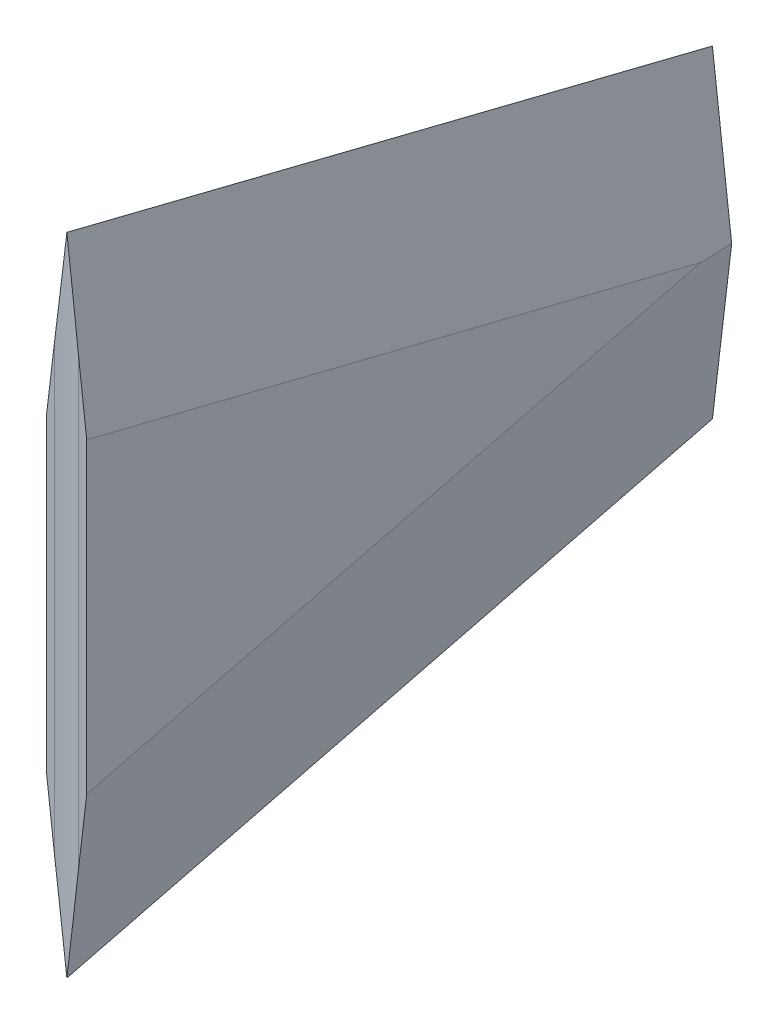
from build123d import *

# Parameters (mm, degrees)
SKETCH1_W               = 101.6
SKETCH1_H               = 50.8
BOSS_EXTRUDE1_DEPTH     = 6.35
CHAMFER1_SIZE           = 3.175
CHAMFER1_SIZE2          = 25.858299909
CHAMFER2_SIZE           = 3.175
CHAMFER2_SIZE_2         = 25.858299909
CHAMFER3_SIZE           = 3.175
CHAMFER3_SIZE2          = 25.858299909
CHAMFER4_SIZE           = 3.175
CHAMFER4_SIZE_2         = 25.858299909
CUT_EXTRUDE1_DEPTH      = 76.2
CUT_EXTRUDE1_DEPTH_BACK = 25.4


with BuildPart() as part:
    # Sketch1 → Boss-Extrude1 (new body)
    with BuildSketch(Plane(origin=(0, 0, 0), x_dir=(0, 0, -1), z_dir=(1, 0, 0))):
        with Locations((50.8, 25.4)):
            Rectangle(SKETCH1_W, SKETCH1_H)
        Polygon((0, 76.2), (101.6, 50.8), (0, 50.8), align=None)
        Polygon((0, 0), (0, -25.4), (101.6, 0), align=None)
    extrude(amount=BOSS_EXTRUDE1_DEPTH)

    # Chamfer1
    chamfer1_edges = [part.edges().sort_by_distance(p)[0] for p in [
        (0, 63.5, -50.8),
    ]]
    chamfer1_side = [part.faces().sort_by_distance(p)[0] for p in [
        (3.175, 63.5, -50.8),
    ]]
    chamfer(chamfer1_edges, length=CHAMFER1_SIZE, length2=CHAMFER1_SIZE2, reference=chamfer1_side[0])

    # Chamfer2
    # the kernel refuses this chamfer: 25.858299909, 3.175 mm, written as the material it takes off along each edge
    with BuildSketch(Plane(origin=(6.35, 92.501557672, 65.20623069), x_dir=(-0.954887306003921, 0.28810166968922074, -0.07202541742230516), z_dir=(0, -0.24253562503633294, -0.970142500145332))) as chamfer2_piece_1:
        Polygon((CHAMFER2_SIZE * 0.954887306004, -CHAMFER2_SIZE * 0.296968403761), (-CHAMFER2_SIZE_2 * 0.296968403759, -CHAMFER2_SIZE_2 * 0.954887305997), (0, 0), align=None)
    extrude(amount=239.152971182, mode=Mode.SUBTRACT)

    # Chamfer3
    chamfer3_edges = [part.edges().sort_by_distance(p)[0] for p in [
        (0, -12.7, -50.8),
    ]]
    chamfer3_side = [part.faces().sort_by_distance(p)[0] for p in [
        (3.175, -12.7, -50.8),
    ]]
    chamfer(chamfer3_edges, length=CHAMFER3_SIZE, length2=CHAMFER3_SIZE2, reference=chamfer3_side[0])

    # Chamfer4
    # the kernel refuses this chamfer: 25.858299909, 3.175 mm, written as the material it takes off along each edge
    with BuildSketch(Plane(origin=(6.35, -41.701557672, 65.20623069), x_dir=(-0.9548873060039216, -0.2881016696892189, -0.07202541742230473), z_dir=(0, 0.24253562503633297, -0.9701425001453319))) as chamfer4_piece_1:
        Polygon((CHAMFER4_SIZE * 0.954887306004, CHAMFER4_SIZE * 0.296968403761), (-CHAMFER4_SIZE_2 * 0.296968403759, CHAMFER4_SIZE_2 * 0.954887305997), (0, 0), align=None)
    extrude(amount=239.152971182, mode=Mode.SUBTRACT)

    # Sketch2 → Cut-Extrude1 (cut, two sides: drawn at the far end of the back side and taken through both)
    with BuildSketch(Plane(origin=(0, 0, 0), x_dir=(1, 0, 0), z_dir=(0, 1, 0)).offset(-CUT_EXTRUDE1_DEPTH_BACK)):
        with BuildLine():
            Line((3.175, -34.036), (-2.377874902, -0.404533862))
            ThreePointArc((-2.377874902, -0.404533862), (3.986335677, 0.041142906), (10.322125098, -0.706905547))
            Line((10.322125098, -0.706905547), (3.175, -34.036))
        make_face()
    extrude(amount=CUT_EXTRUDE1_DEPTH + CUT_EXTRUDE1_DEPTH_BACK, mode=Mode.SUBTRACT)


solid = part.part
